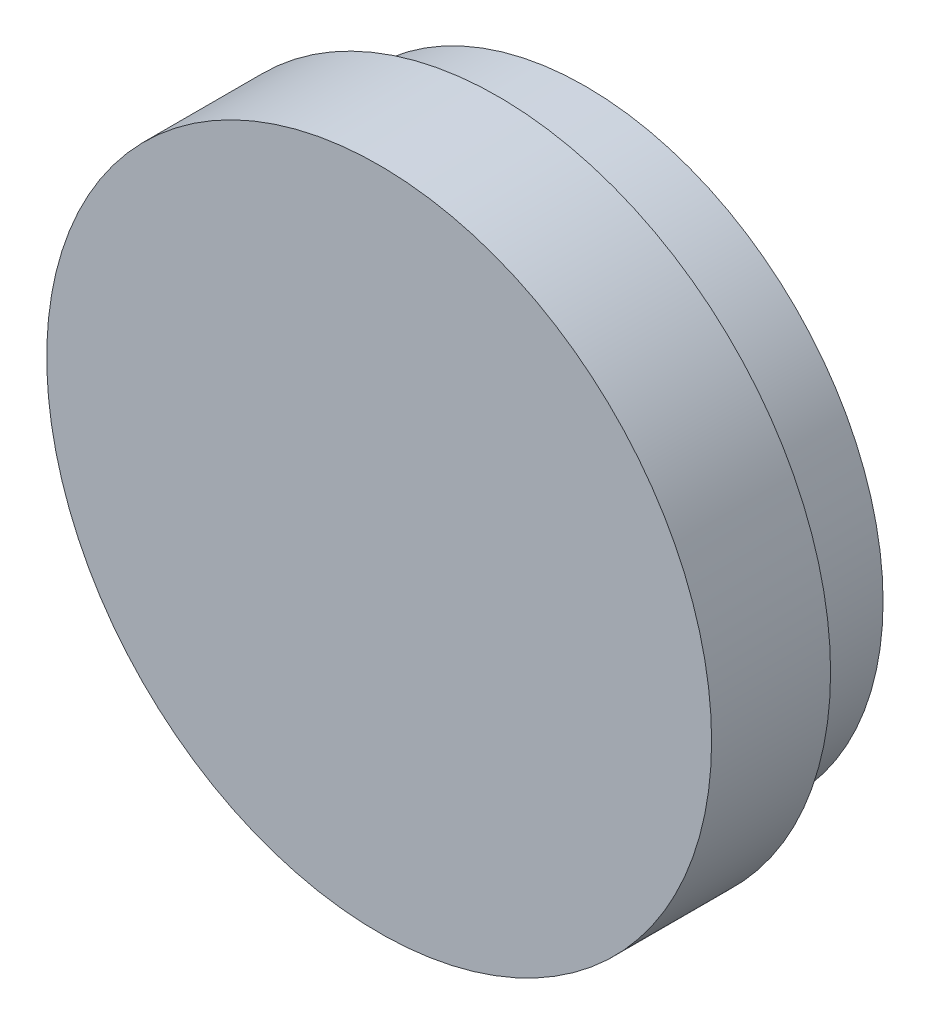
from build123d import *

# Parameters (mm, degrees)
SKETCH_1_R      = 8.5
EXTRUDE_1_DEPTH = 2.5
SKETCH_2_R      = 9.5
EXTRUDE_2_DEPTH = 3.4


with BuildPart() as part:
    # ｽｹｯﾁ1 → ﾎﾞｽ - 押し出し1 (new body)
    with BuildSketch(Plane.XY):
        Circle(SKETCH_1_R)
    extrude(amount=EXTRUDE_1_DEPTH)

    # ｽｹｯﾁ2 → ﾎﾞｽ - 押し出し2 (add)
    with BuildSketch(Plane.XY.offset(2.5)):
        Circle(SKETCH_2_R)
    extrude(amount=EXTRUDE_2_DEPTH)


solid = part.part
